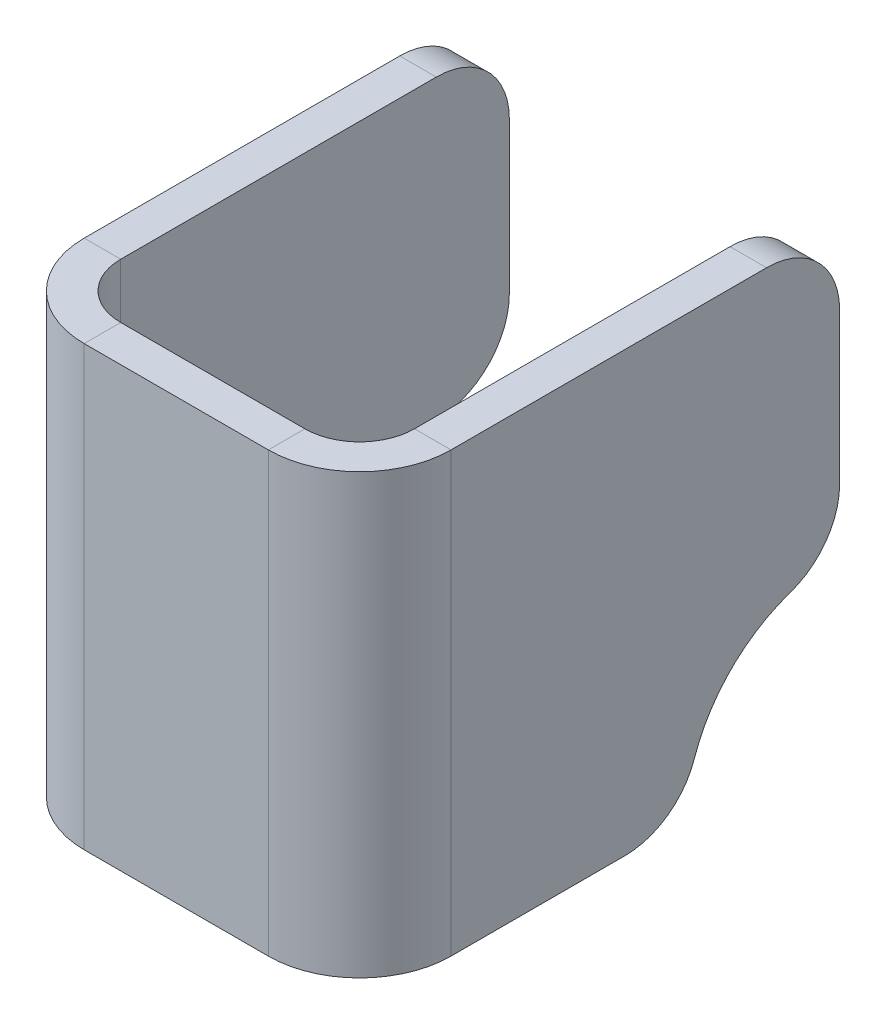
from build123d import *

# Parameters (mm, degrees)
SKETCH1_W                      = 31.877
SKETCH1_H                      = 38.1
BASE_FLANGE1_DEPTH             = 3.175
EDGE_FLANGE1_STRIP_W           = 22.225
EDGE_FLANGE1_STRIP_H           = 3.175
EDGE_FLANGE1_STRIP_CUT_DEPTH   = 38.1
EDGE_FLANGE1_STRIP_2_W         = 22.225
EDGE_FLANGE1_STRIP_2_H         = 3.175
EDGE_FLANGE1_STRIP_CUT_2_DEPTH = 38.1
EDGE_FLANGE1_DEPTH             = 38.1
EDGE_FLANGE1_BEND_DEPTH        = 38.1
CUT_EXTRUDE1_DEPTH             = 95.152162324
CUT_EXTRUDE1_DEPTH_BACK        = 95.152162324
SKETCH12_R                     = 13.335
BREAK_CORNER1_START            = 0.424763322
BREAK_CORNER1_DEPTH            = 31.877


# Read off the part's stored shape, not the designer's step: Break-Corner1
# Sheet-metal steps are written as plain solids
with BuildPart() as part:
    # Sketch1 → Base-Flange1 (new body)
    with BuildSketch(Plane.XY.offset(-38.1)):
        with Locations((16.363263322, 19.05)):
            Rectangle(SKETCH1_W, SKETCH1_H)
    extrude(amount=-BASE_FLANGE1_DEPTH)

    # Edge-Flange1 strip (across the edge) → Edge-Flange1 strip cut (cut)
    with BuildSketch(Plane(origin=(32.301763322, 38.1, -41.275), x_dir=(-1, 0, 0), z_dir=(0, -1, 0))):
        with Locations((-3.175, -1.5875)):
            Rectangle(EDGE_FLANGE1_STRIP_W, EDGE_FLANGE1_STRIP_H)
    extrude(amount=EDGE_FLANGE1_STRIP_CUT_DEPTH, mode=Mode.SUBTRACT)

    # Edge-Flange1 strip 2 (across the edge) → Edge-Flange1 strip cut 2 (cut)
    with BuildSketch(Plane(origin=(0.424763322, 0, -41.275), x_dir=(1, 0, 0), z_dir=(0, 1, 0))):
        with Locations((-3.175, -1.5875)):
            Rectangle(EDGE_FLANGE1_STRIP_2_W, EDGE_FLANGE1_STRIP_2_H)
    extrude(amount=EDGE_FLANGE1_STRIP_CUT_2_DEPTH, mode=Mode.SUBTRACT)

    # Edge-Flange1 section (across the edge) → Edge-Flange1 (add)
    with BuildSketch(Plane(origin=(32.301763322, 38.1, -41.275), x_dir=(-1, 0, 0), z_dir=(0, -1, 0))):
        with BuildLine():
            Line((0, 4.7625), (0, 38.534872551))
            Line((0, 38.534872551), (3.175, 38.534872551))
            Line((3.175, 38.534872551), (3.175, 4.7625))
            ThreePointArc((3.175, 4.7625), (4.569903955, 1.394903955), (7.9375, 0))
            Line((7.9375, 0), (7.9375, -3.175))
            ThreePointArc((7.9375, -3.175), (2.324839924, -0.850160076), (0, 4.7625))
        make_face()
    extrude(amount=EDGE_FLANGE1_DEPTH)

    # Edge-Flange1 section 2 (across the edge) → Edge-Flange1 bend (add)
    with BuildSketch(Plane(origin=(0.424763322, 0, -41.275), x_dir=(1, 0, 0), z_dir=(0, 1, 0))):
        with BuildLine():
            Line((0, 4.7625), (0, 38.534872551))
            Line((0, 38.534872551), (3.175, 38.534872551))
            Line((3.175, 38.534872551), (3.175, 4.7625))
            ThreePointArc((3.175, 4.7625), (4.569903955, 1.394903955), (7.9375, 0))
            Line((7.9375, 0), (7.9375, -3.175))
            ThreePointArc((7.9375, -3.175), (2.324839924, -0.850160076), (0, 4.7625))
        make_face()
    extrude(amount=EDGE_FLANGE1_BEND_DEPTH)

    # Sketch12 → Cut-Extrude1 (cut, two sides: drawn at the far end of the back side and taken through both)
    with BuildSketch(Plane(origin=(0, 0, 0), x_dir=(0, 0, -1), z_dir=(1, 0, 0)).offset(-CUT_EXTRUDE1_DEPTH_BACK)):
        with Locations((79.809872551, 0)):
            Circle(SKETCH12_R)
    extrude(amount=CUT_EXTRUDE1_DEPTH + CUT_EXTRUDE1_DEPTH_BACK, mode=Mode.SUBTRACT)

    # Break-Corner1 outline → Break-Corner1 (cut)
    with BuildSketch(Plane.YZ.offset(BREAK_CORNER1_START)):
        with BuildLine():
            Line((13.335, -79.809872551), (18.632678954, -79.809872551))
            ThreePointArc((18.632678954, -79.809872551), (14.937057089, -78.623677256), (12.622137356, -75.508259648))
            ThreePointArc((12.622137356, -75.508259648), (13.15557727, -77.629732262), (13.335, -79.809872551))
        make_face()
        with BuildLine():
            ThreePointArc((38.1, -73.459872551), (36.24012806, -77.950000612), (31.75, -79.809872551))
            Line((31.75, -79.809872551), (38.1, -79.809872551))
            Line((38.1, -79.809872551), (38.1, -73.459872551))
        make_face()
        with BuildLine():
            ThreePointArc((0, -66.474872551), (2.180140289, -66.654295281), (4.301612903, -67.187735195))
            ThreePointArc((4.301612903, -67.187735195), (1.186195295, -64.872815462), (0, -61.177193597))
            Line((0, -61.177193597), (0, -66.474872551))
        make_face()
    extrude(amount=BREAK_CORNER1_DEPTH, mode=Mode.SUBTRACT)


solid = part.part
